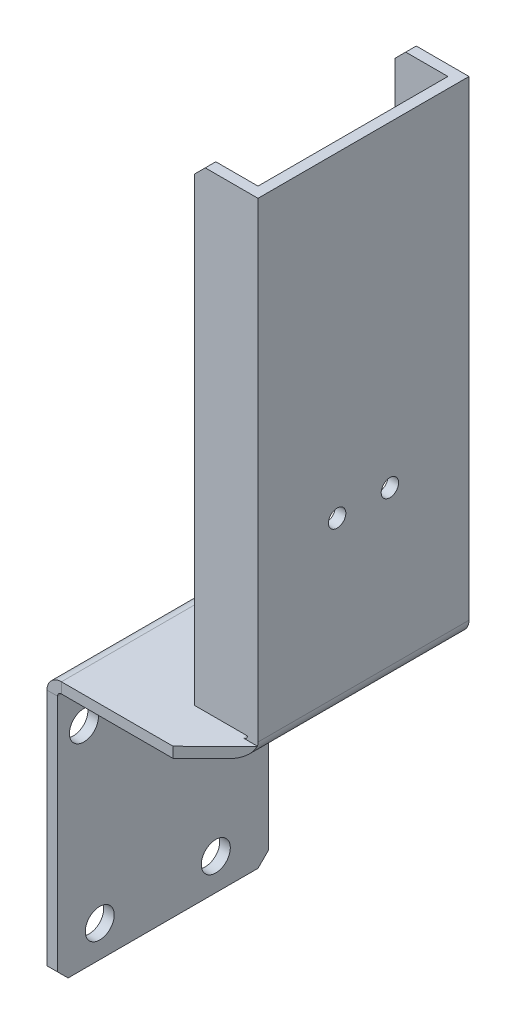
from build123d import *

# Parameters (mm, degrees)
SM_BASE_FLANGE_1_DEPTH = 24
SKETCH_3_R             = 2.75
CUT_EXTRUDE_1_DEPTH    = 146.175755552
SKETCH_4_W             = 8
SKETCH_4_H             = 90
SKETCH_4_H_2           = 47.2634
CUT_EXTRUDE_2_DEPTH    = 146.602197786
CUT_EXTRUDE_3_DEPTH    = 99.488578018
SKETCH_9_W             = 2
SKETCH_9_H             = 89.2634
EXTRUDE_1_DEPTH        = 10
CHAMFER_1_SIZE         = 2
M4X0_7_1_D             = 3.3
M4X0_7_1_DEPTH         = 10.1
M4X0_7_1_TIP           = 0.991420021
SKETCH_12_R            = 8
CUT_EXTRUDE_4_DEPTH    = 99.488578018
SKETCH_13_R            = 2.75
CUT_EXTRUDE_5_DEPTH    = 146.175755552


# Sheet-metal steps are written as plain solids
with BuildPart() as part:
    # Sketch 1 → 基体-法兰1 (new, symmetric)
    with BuildSketch(Plane.XY):
        with BuildLine():
            Line((0, 0), (0, 47.2634))
            ThreePointArc((0, 47.2634), (0.801531583, 49.198468417), (2.7366, 50))
            Line((2.7366, 50), (29.2634, 50))
            ThreePointArc((29.2634, 50), (29.784254855, 50.215745145), (30, 50.7366))
            Line((30, 50.7366), (30, 140))
            Line((30, 140), (32, 140))
            Line((32, 140), (32, 50.7366))
            ThreePointArc((32, 50.7366), (31.198468417, 48.801531583), (29.2634, 48))
            Line((29.2634, 48), (2.7366, 48))
            ThreePointArc((2.7366, 48), (2.215745145, 47.784254855), (2, 47.2634))
            Line((2, 47.2634), (2, 0))
            Line((2, 0), (0, 0))
        make_face()
    extrude(amount=SM_BASE_FLANGE_1_DEPTH, both=True)

    # 草图3 → 切除-拉伸1 (cut, through all)
    with BuildSketch(Plane(origin=(2, 0, 0), x_dir=(0, 0, -1), z_dir=(1, 0, 0))):
        with Locations((-16, 6)):
            Circle(SKETCH_3_R)
        with Locations(Location((6, 6, 0), (0, 0, 180))):
            Circle(SKETCH_3_R)
    extrude(amount=-CUT_EXTRUDE_1_DEPTH, mode=Mode.SUBTRACT)

    # 草图4 → 切除-拉伸2 (cut, through all)
    with BuildSketch(Plane.ZY):
        with Locations((20, 95)):
            Rectangle(SKETCH_4_W, SKETCH_4_H)
        with Locations((-20, 23.6317)):
            Rectangle(SKETCH_4_W, SKETCH_4_H_2)
    extrude(amount=-CUT_EXTRUDE_2_DEPTH, mode=Mode.SUBTRACT)

    # 草图5 → 切除-拉伸3 (cut, through all)
    with BuildSketch(Plane(origin=(0, 50, 0), x_dir=(1, 0, 0), z_dir=(0, 1, 0))):
        Polygon((0, 24), (8, 24), (0, 16), align=None)
        Polygon((32, -16), (23.898364891, -24), (31.899002398, -24), align=None)
    extrude(amount=-CUT_EXTRUDE_3_DEPTH, mode=Mode.SUBTRACT)

    # 草图9 → 凸台-拉伸1 (add)
    with BuildSketch(Plane.ZY.offset(-30)):
        with Locations((-23, 95.3683)):
            Rectangle(SKETCH_9_W, SKETCH_9_H)
        with Locations((15, 95.3683)):
            Rectangle(SKETCH_9_W, SKETCH_9_H)
    extrude(amount=EXTRUDE_1_DEPTH)

    # 倒角1
    chamfer_1_edges = [part.edges().sort_by_distance(p)[0] for p in [
        (20, 140, -23),
        (20, 140, 15),
        (1, 0, 24),
        (1, 0, -16),
    ]]
    chamfer(chamfer_1_edges, length=CHAMFER_1_SIZE)

    # M4x0.7 螺纹孔1
    with Locations(Plane(origin=(32, 0, 0), x_dir=(0, 0, -1), z_dir=(1, 0, 0))):
        with Locations((-1, 80), (9, 80)):
            Hole(M4X0_7_1_D / 2, depth=M4X0_7_1_DEPTH)
            with Locations((0, 0, -(M4X0_7_1_DEPTH + M4X0_7_1_TIP / 2))):  # 118° drill point
                Cone(0, M4X0_7_1_D / 2, M4X0_7_1_TIP, mode=Mode.SUBTRACT)

    # 草图12 → 切除-拉伸4 (cut, through all)
    with BuildSketch(Plane(origin=(0, 50, 0), x_dir=(1, 0, 0), z_dir=(0, 1, 0))):
        with Locations(Location((16, 0, 0), (0, 0, 270))):
            Circle(SKETCH_12_R)
    extrude(amount=-CUT_EXTRUDE_4_DEPTH, mode=Mode.SUBTRACT)

    # 草图13 → 切除-拉伸5 (cut, through all)
    with BuildSketch(Plane(origin=(2, 0, 0), x_dir=(0, 0, -1), z_dir=(1, 0, 0))):
        with Locations((-19, 40)):
            Circle(SKETCH_13_R)
    extrude(amount=-CUT_EXTRUDE_5_DEPTH, mode=Mode.SUBTRACT)


solid = part.part
